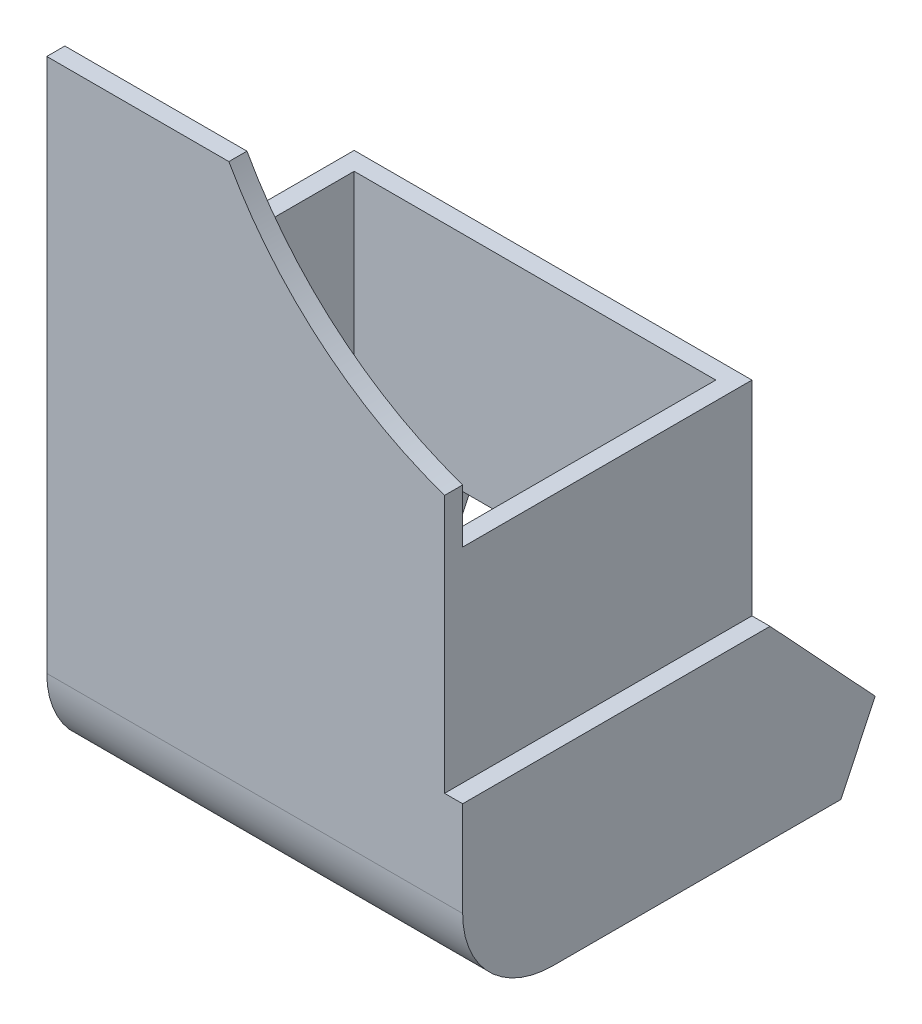
from build123d import *

# Parameters (mm, degrees)
SKETCH1_W           = 23
SKETCH1_H           = 17
BOSS_EXTRUDE1_DEPTH = 10.256
BOSS_EXTRUDE2_DEPTH = 23
SHELL1_T            = -1.044
SKETCH3_W           = 22
SKETCH3_H           = 17
BOSS_EXTRUDE3_DEPTH = 24.294
SHELL2_START        = 1
SHELL2_OUTLINE_W    = 24.338
SHELL2_OUTLINE_H    = 15
SHELL2_DEPTH        = 20
SKETCH4_W           = 20
SKETCH4_H           = 15
CUT_EXTRUDE1_DEPTH  = 3.294
SKETCH5_W           = 16
SKETCH5_H           = 13
CUT_EXTRUDE2_DEPTH  = 26.294
CUT_EXTRUDE3_DEPTH  = 26.294
FILLET1_R           = 5
FILLET2_R           = 5


# Read off the part's stored shape, not the designer's step: Shell2
with BuildPart() as part:
    # Sketch1 → Boss-Extrude1 (new body)
    with BuildSketch(Plane(origin=(0, 0, 0), x_dir=(1, 0, 0), z_dir=(0, 1, 0))):
        with Locations((11.5, 8.5)):
            Rectangle(SKETCH1_W, SKETCH1_H)
    extrude(amount=BOSS_EXTRUDE1_DEPTH)

    # Sketch2 → Boss-Extrude2 (add)
    with BuildSketch(Plane(origin=(23, 0, 0), x_dir=(0, 0, -1), z_dir=(1, 0, 0))):
        Polygon((17, 0), (20.918, 0), (22.816626616, 4.000300111), (17, 10.256), align=None)
    extrude(amount=-BOSS_EXTRUDE2_DEPTH)

    # Shell1
    shell1_openings = [part.faces().sort_by_distance(p)[0] for p in [
        (11.5, 2.000150055, -21.867313308),
    ]]
    offset(amount=SHELL1_T, openings=shell1_openings, kind=Kind.INTERSECTION)

    # Sketch3 → Boss-Extrude3 (add)
    with BuildSketch(Plane(origin=(0, 10.256, 0), x_dir=(1, 0, 0), z_dir=(0, 1, 0))):
        with Locations((11, 8.5)):
            Rectangle(SKETCH3_W, SKETCH3_H)
    extrude(amount=BOSS_EXTRUDE3_DEPTH)

    # Shell2 outline → Shell2 (cut)
    with BuildSketch(Plane.YZ.offset(SHELL2_START)):
        with Locations((22.381, -8.5)):
            Rectangle(SHELL2_OUTLINE_W, SHELL2_OUTLINE_H)
    extrude(amount=SHELL2_DEPTH, mode=Mode.SUBTRACT)

    # Sketch4 → Cut-Extrude1 (cut)
    with BuildSketch(Plane(origin=(0, 10.212, 0), x_dir=(1, 0, 0), z_dir=(0, 1, 0))):
        with Locations((11, 8.5)):
            Rectangle(SKETCH4_W, SKETCH4_H)
    extrude(amount=-CUT_EXTRUDE1_DEPTH, mode=Mode.SUBTRACT)

    # Sketch5 → Cut-Extrude2 (cut)
    with BuildSketch(Plane(origin=(22, 0, 0), x_dir=(0, 0, -1), z_dir=(1, 0, 0))):
        with Locations((9, 28.05)):
            Rectangle(SKETCH5_W, SKETCH5_H)
    extrude(amount=-CUT_EXTRUDE2_DEPTH, mode=Mode.SUBTRACT)

    # Sketch6 → Cut-Extrude3 (cut)
    with BuildSketch(Plane.XY):
        with BuildLine():
            Line((22, 34.55), (10.070124752, 34.55))
            ThreePointArc((10.070124752, 34.55), (15.112523328, 28.440572535), (22, 24.5273191))
            Line((22, 24.5273191), (22, 34.55))
        make_face()
    extrude(amount=-CUT_EXTRUDE3_DEPTH, mode=Mode.SUBTRACT)

    # Fillet1
    fillet1_edges = [part.edges().sort_by_distance(p)[0] for p in [
        (11.5, 0, 0),
    ]]
    fillet(fillet1_edges, radius=FILLET1_R)

    # Fillet2
    fillet2_edges = [part.edges().sort_by_distance(p)[0] for p in [
        (11.5, 1.044, -1.044),
    ]]
    fillet(fillet2_edges, radius=FILLET2_R)


solid = part.part
